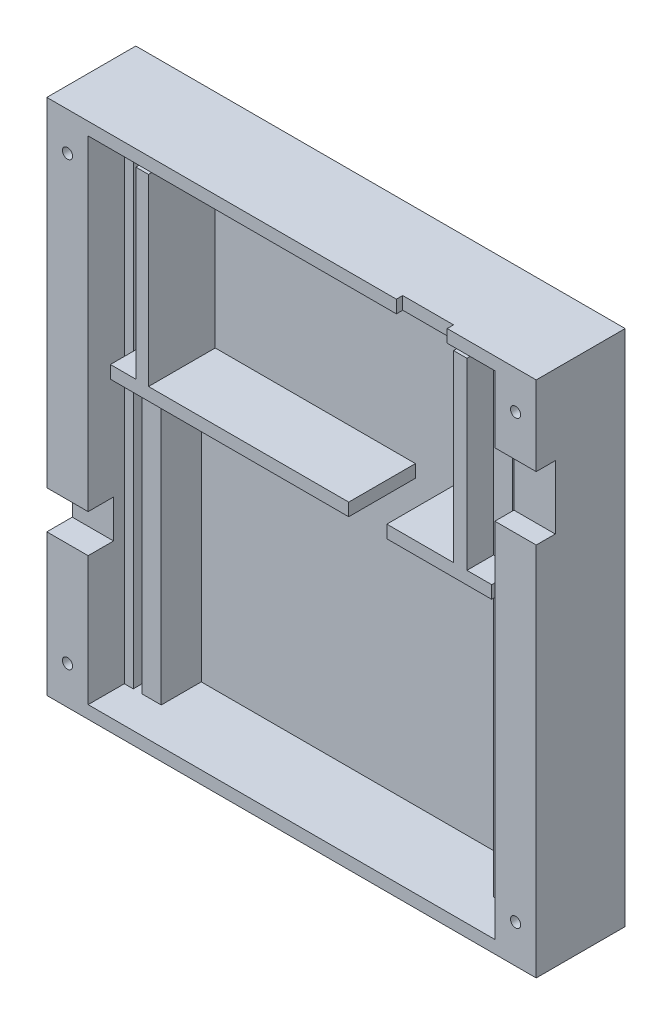
from build123d import *

# Parameters (mm, degrees)
SKETCH1_W            = 81.5
SKETCH1_H            = 77
BOSS_EXTRUDE1_DEPTH  = 2
SKETCH2_W            = 81.5
SKETCH2_H            = 6.5
BOSS_EXTRUDE2_DEPTH  = 10
SKETCH3_W            = 22.3
SKETCH3_H            = 6.5
BOSS_EXTRUDE3_DEPTH  = 14
SKETCH4_W            = 53.2
SKETCH4_H            = 6.5
BOSS_EXTRUDE4_DEPTH  = 14
SKETCH5_W            = 81.5
SKETCH5_H            = 6.5
BOSS_EXTRUDE5_DEPTH  = 11
SKETCH6_W            = 59
SKETCH6_H            = 6.5
BOSS_EXTRUDE6_DEPTH  = 14
SKETCH7_W            = 12.5
SKETCH7_H            = 6.5
BOSS_EXTRUDE7_DEPTH  = 14
SKETCH8_W            = 2
SKETCH8_H            = 64
BOSS_EXTRUDE8_DEPTH  = 14
SKETCH9_W            = 2
SKETCH9_H            = 64
BOSS_EXTRUDE9_DEPTH  = 13
SKETCH10_W           = 2
SKETCH10_H           = 48.5
BOSS_EXTRUDE10_DEPTH = 14
SKETCH11_W           = 2
SKETCH11_H           = 7.5
BOSS_EXTRUDE11_DEPTH = 14
SKETCH12_W           = 77.5
SKETCH12_H           = 1.4
BOSS_EXTRUDE12_DEPTH = 8.3
SKETCH13_W           = 77.5
SKETCH13_H           = 3
BOSS_EXTRUDE13_DEPTH = 8.3
SKETCH14_W           = 77.5
SKETCH14_H           = 3
BOSS_EXTRUDE14_DEPTH = 8.3
SKETCH15_W           = 77.5
SKETCH15_H           = 1.5
BOSS_EXTRUDE15_DEPTH = 8.3
SKETCH16_W           = 2
SKETCH16_H           = 37.5
BOSS_EXTRUDE16_DEPTH = 12.5
SKETCH17_W           = 2
SKETCH17_H           = 16.5
BOSS_EXTRUDE17_DEPTH = 12.5
SKETCH18_W           = 28.9
SKETCH18_H           = 2
BOSS_EXTRUDE18_DEPTH = 12.5
SKETCH19_W           = 28.9
SKETCH19_H           = 2.1
BOSS_EXTRUDE19_DEPTH = 12.5
SKETCH20_R           = 0.8
CUT_EXTRUDE1_DEPTH   = 20
SKETCH21_R           = 0.8
CUT_EXTRUDE2_DEPTH   = 20
SKETCH22_R           = 0.8
CUT_EXTRUDE3_DEPTH   = 20
SKETCH23_R           = 0.8
CUT_EXTRUDE4_DEPTH   = 20


with BuildPart() as part:
    # Sketch1 → Boss-Extrude1 (new body)
    with BuildSketch(Plane(origin=(0, 0, 0), x_dir=(0, 1, 0), z_dir=(0, 0, 1))):
        with Locations((40.75, -38.5)):
            Rectangle(SKETCH1_W, SKETCH1_H)
    extrude(amount=BOSS_EXTRUDE1_DEPTH)

    # Sketch2 → Boss-Extrude2 (add)
    with BuildSketch(Plane(origin=(0, 0, 0), x_dir=(0, 1, 0), z_dir=(0, 0, 1))):
        with Locations((40.75, -3.25)):
            Rectangle(SKETCH2_W, SKETCH2_H)
    extrude(amount=BOSS_EXTRUDE2_DEPTH)

    # Sketch3 → Boss-Extrude3 (add)
    with BuildSketch(Plane(origin=(0, 0, 0), x_dir=(0, 1, 0), z_dir=(0, 0, 1))):
        with Locations((11.15, -3.25)):
            Rectangle(SKETCH3_W, SKETCH3_H)
    extrude(amount=BOSS_EXTRUDE3_DEPTH)

    # Sketch4 → Boss-Extrude4 (add)
    with BuildSketch(Plane(origin=(0, 0, 0), x_dir=(0, 1, 0), z_dir=(0, 0, 1))):
        with Locations((54.9, -3.25)):
            Rectangle(SKETCH4_W, SKETCH4_H)
    extrude(amount=BOSS_EXTRUDE4_DEPTH)

    # Sketch5 → Boss-Extrude5 (add)
    with BuildSketch(Plane(origin=(0, 0, 0), x_dir=(0, 1, 0), z_dir=(0, 0, 1))):
        with Locations((40.75, -73.75)):
            Rectangle(SKETCH5_W, SKETCH5_H)
    extrude(amount=BOSS_EXTRUDE5_DEPTH)

    # Sketch6 → Boss-Extrude6 (add)
    with BuildSketch(Plane(origin=(0, 0, 0), x_dir=(0, 1, 0), z_dir=(0, 0, 1))):
        with Locations((29.5, -73.75)):
            Rectangle(SKETCH6_W, SKETCH6_H)
    extrude(amount=BOSS_EXTRUDE6_DEPTH)

    # Sketch7 → Boss-Extrude7 (add)
    with BuildSketch(Plane(origin=(0, 0, 0), x_dir=(0, 1, 0), z_dir=(0, 0, 1))):
        with Locations((75.25, -73.75)):
            Rectangle(SKETCH7_W, SKETCH7_H)
    extrude(amount=BOSS_EXTRUDE7_DEPTH)

    # Sketch8 → Boss-Extrude8 (add)
    with BuildSketch(Plane(origin=(0, 0, 0), x_dir=(0, 1, 0), z_dir=(0, 0, 1))):
        with Locations((1, -38.5)):
            Rectangle(SKETCH8_W, SKETCH8_H)
    extrude(amount=BOSS_EXTRUDE8_DEPTH)

    # Sketch9 → Boss-Extrude9 (add)
    with BuildSketch(Plane(origin=(0, 0, 0), x_dir=(0, 1, 0), z_dir=(0, 0, 1))):
        with Locations((80.5, -38.5)):
            Rectangle(SKETCH9_W, SKETCH9_H)
    extrude(amount=BOSS_EXTRUDE9_DEPTH)

    # Sketch10 → Boss-Extrude10 (add)
    with BuildSketch(Plane(origin=(0, 0, 0), x_dir=(0, 1, 0), z_dir=(0, 0, 1))):
        with Locations((80.5, -30.75)):
            Rectangle(SKETCH10_W, SKETCH10_H)
    extrude(amount=BOSS_EXTRUDE10_DEPTH)

    # Sketch11 → Boss-Extrude11 (add)
    with BuildSketch(Plane(origin=(0, 0, 0), x_dir=(0, 1, 0), z_dir=(0, 0, 1))):
        with Locations((80.5, -66.75)):
            Rectangle(SKETCH11_W, SKETCH11_H)
    extrude(amount=BOSS_EXTRUDE11_DEPTH)

    # Sketch12 → Boss-Extrude12 (add)
    with BuildSketch(Plane(origin=(0, 0, 0), x_dir=(0, 1, 0), z_dir=(0, 0, 1))):
        with Locations((40.75, -7.2)):
            Rectangle(SKETCH12_W, SKETCH12_H)
    extrude(amount=BOSS_EXTRUDE12_DEPTH)

    # Sketch13 → Boss-Extrude13 (add)
    with BuildSketch(Plane(origin=(0, 0, 0), x_dir=(0, 1, 0), z_dir=(0, 0, 1))):
        with Locations((40.75, -10.8)):
            Rectangle(SKETCH13_W, SKETCH13_H)
    extrude(amount=BOSS_EXTRUDE13_DEPTH)

    # Sketch14 → Boss-Extrude14 (add)
    with BuildSketch(Plane(origin=(0, 0, 0), x_dir=(0, 1, 0), z_dir=(0, 0, 1))):
        with Locations((40.75, -66.1)):
            Rectangle(SKETCH14_W, SKETCH14_H)
    extrude(amount=BOSS_EXTRUDE14_DEPTH)

    # Sketch15 → Boss-Extrude15 (add)
    with BuildSketch(Plane(origin=(0, 0, 0), x_dir=(0, 1, 0), z_dir=(0, 0, 1))):
        with Locations((40.75, -69.75)):
            Rectangle(SKETCH15_W, SKETCH15_H)
    extrude(amount=BOSS_EXTRUDE15_DEPTH)

    # Sketch16 → Boss-Extrude16 (add)
    with BuildSketch(Plane(origin=(0, 0, 0), x_dir=(0, 1, 0), z_dir=(0, 0, 1))):
        with Locations((47.6, -27.25)):
            Rectangle(SKETCH16_W, SKETCH16_H)
    extrude(amount=BOSS_EXTRUDE16_DEPTH)

    # Sketch17 → Boss-Extrude17 (add)
    with BuildSketch(Plane(origin=(0, 0, 0), x_dir=(0, 1, 0), z_dir=(0, 0, 1))):
        with Locations((47.6, -60.25)):
            Rectangle(SKETCH17_W, SKETCH17_H)
    extrude(amount=BOSS_EXTRUDE17_DEPTH)

    # Sketch18 → Boss-Extrude18 (add)
    with BuildSketch(Plane(origin=(0, 0, 0), x_dir=(0, 1, 0), z_dir=(0, 0, 1))):
        with Locations((63.05, -13.5)):
            Rectangle(SKETCH18_W, SKETCH18_H)
    extrude(amount=BOSS_EXTRUDE18_DEPTH)

    # Sketch19 → Boss-Extrude19 (add)
    with BuildSketch(Plane(origin=(0, 0, 0), x_dir=(0, 1, 0), z_dir=(0, 0, 1))):
        with Locations((63.05, -63.55)):
            Rectangle(SKETCH19_W, SKETCH19_H)
    extrude(amount=BOSS_EXTRUDE19_DEPTH)

    # Sketch20 → Cut-Extrude1 (cut)
    with BuildSketch(Plane(origin=(0, 0, 0), x_dir=(0, 1, 0), z_dir=(0, 0, 1))):
        with Locations((6, -3.25)):
            Circle(SKETCH20_R)
    extrude(amount=CUT_EXTRUDE1_DEPTH, mode=Mode.SUBTRACT)

    # Sketch21 → Cut-Extrude2 (cut)
    with BuildSketch(Plane(origin=(0, 0, 0), x_dir=(0, 1, 0), z_dir=(0, 0, 1))):
        with Locations((75.5, -3.25)):
            Circle(SKETCH21_R)
    extrude(amount=CUT_EXTRUDE2_DEPTH, mode=Mode.SUBTRACT)

    # Sketch22 → Cut-Extrude3 (cut)
    with BuildSketch(Plane(origin=(0, 0, 0), x_dir=(0, 1, 0), z_dir=(0, 0, 1))):
        with Locations((6, -73.75)):
            Circle(SKETCH22_R)
    extrude(amount=CUT_EXTRUDE3_DEPTH, mode=Mode.SUBTRACT)

    # Sketch23 → Cut-Extrude4 (cut)
    with BuildSketch(Plane(origin=(0, 0, 0), x_dir=(0, 1, 0), z_dir=(0, 0, 1))):
        with Locations((75.5, -73.75)):
            Circle(SKETCH23_R)
    extrude(amount=CUT_EXTRUDE4_DEPTH, mode=Mode.SUBTRACT)


solid = part.part
